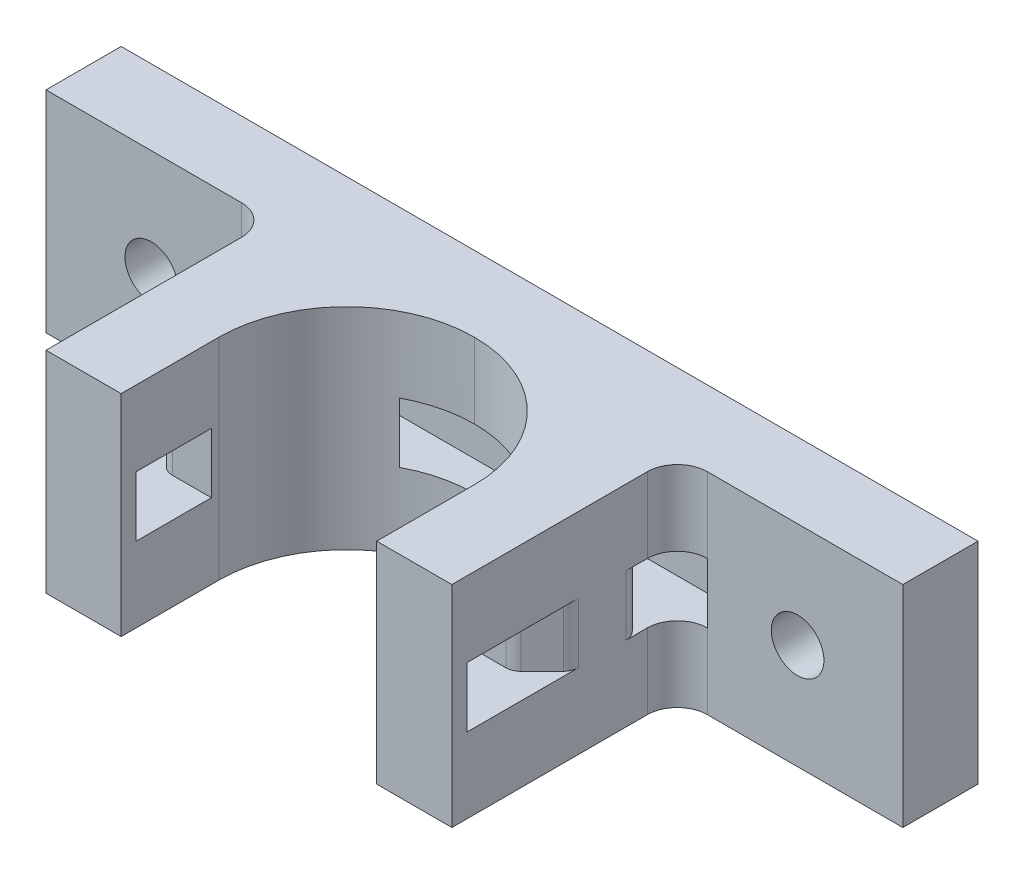
from build123d import *

# Parameters (mm, degrees)
ESQUISSE1_W             = 57
ESQUISSE1_H             = 14
ESQUISSE1_R             = 1.75
BOSS_EXTRU_1_DEPTH      = 5
ESQUISSE2_W             = 5
ESQUISSE2_H             = 14
BOSS_EXTRU_2_DEPTH      = 15
CONG_1_R                = 8.5
ESQUISSE3_W             = 5
ESQUISSE3_H             = 4
ESQUISSE3_W_2           = 3
ENL_V_MAT_EXTRU_1_DEPTH = 27
CHANFREIN1_SIZE         = 2
CONG_2_R                = 1
ESQUISSE6_W             = 0.628205128
ESQUISSE6_H             = 3.5
BOSS_EXTRU_3_DEPTH      = 0.5
CONG_3_R                = 2


with BuildPart() as part:
    # Esquisse1 → Boss.-Extru.1 (new body)
    with BuildSketch(Plane.XY):
        with Locations((28.5, -7)):
            Rectangle(ESQUISSE1_W, ESQUISSE1_H)
        with Locations((7, -7)):
            Circle(ESQUISSE1_R, mode=Mode.SUBTRACT)
        with Locations((50, -7)):
            Circle(ESQUISSE1_R, mode=Mode.SUBTRACT)
    extrude(amount=BOSS_EXTRU_1_DEPTH)

    # Esquisse2 → Boss.-Extru.2 (add)
    with BuildSketch(Plane.XY.offset(5)):
        with Locations((17.5, -7)):
            Rectangle(ESQUISSE2_W, ESQUISSE2_H)
        with Locations((39.5, -7)):
            Rectangle(ESQUISSE2_W, ESQUISSE2_H)
    extrude(amount=BOSS_EXTRU_2_DEPTH)

    # Congé1
    cong_1_edges = [part.edges().sort_by_distance(p)[0] for p in [
        (20, -7, 5),
        (37, -7, 5),
    ]]
    fillet(cong_1_edges, radius=CONG_1_R - 0.0001)  # a hair under: the kernel refuses the full size

    # Esquisse3 → Enlèv. mat.-Extru.1 (cut)
    with BuildSketch(Plane.ZY.offset(-15)):
        with Locations((16.5, -7)):
            Rectangle(ESQUISSE3_W, ESQUISSE3_H)
        with Locations((4.5, -7)):
            Rectangle(ESQUISSE3_W_2, ESQUISSE3_H)
    extrude(amount=-ENL_V_MAT_EXTRU_1_DEPTH, mode=Mode.SUBTRACT)

    # Chanfrein1
    chanfrein1_edges = [part.edges().sort_by_distance(p)[0] for p in [
        (42, -7, 14),
        (15, -7, 14),
        (42, -7, 5),
        (15, -7, 5),
        (15, -7, 6),
        (42, -7, 6),
    ]]
    chamfer(chanfrein1_edges, length=CHANFREIN1_SIZE - 0.0001)  # a hair under: the kernel refuses the full size

    # Congé2
    cong_2_edges = [part.edges().sort_by_distance(p)[0] for p in [
        (42, -7, 7.9999),
        (42, -7, 12.0001),
        (40.0001, -7, 14),
        (16.9999, -7, 14),
        (15, -7, 7.9999),
        (15, -7, 12.0001),
        (16.9999, -7, 6),
        (40.0001, -7, 6),
    ]]
    fillet(cong_2_edges, radius=CONG_2_R)

    # Esquisse6 → Boss.-Extru.3 (add)
    # profile 1 of 10: a face of its own
    with BuildSketch(Plane.XZ.offset(14)):
        with BuildLine():
            Line((16.069811699, 3.693309295), (15.594451122, 3.23828125))
            add(Edge.make_bspline(
                [(15.594451122, 3.23828125), (15.556815995, 3.27596147), (15.482969664, 3.349896282), (15.362203227, 3.446127521), (15.23712585, 3.527943098), (15.107325853, 3.595217589), (14.972622424, 3.647401533), (14.83328139, 3.684730378), (14.689076061, 3.706870748), (14.591455491, 3.709970324), (14.542067308, 3.711538462)],
                knots=[0, 0, 0, 0, 1.075575784, 2.110457258, 3.113929901, 4.09197124, 5.059417775, 6.02750972, 7.002078037, 8, 8, 8, 8], degree=3))
            add(Edge.make_bspline(
                [(14.542067308, 3.711538462), (14.499249263, 3.710439675), (14.415172278, 3.708282111), (14.291629247, 3.691897718), (14.173576313, 3.664528327), (14.060455745, 3.626612606), (13.952958184, 3.577272269), (13.850460769, 3.517268826), (13.753594269, 3.446143247), (13.663121439, 3.365243825), (13.580745636, 3.276917989), (13.508827211, 3.182378112), (13.447568163, 3.083386338), (13.397139473, 2.979436209), (13.358768723, 2.870687268), (13.331377029, 2.757218462), (13.313990115, 2.639359546), (13.31193724, 2.558954974), (13.310897436, 2.518229167)],
                knots=[0, 0, 0, 0, 1.075001177, 2.110859044, 3.123021556, 4.114053297, 5.101481495, 6.087880186, 7.091499647, 8.114004866, 9.131394192, 10.11971144, 11.092043119, 12.050101265, 13.015322563, 13.981809771, 14.977764287, 16, 16, 16, 16], degree=3))
            add(Edge.make_bspline(
                [(13.310897436, 2.518229167), (13.311867315, 2.476093785), (13.313778111, 2.393081314), (13.33213346, 2.271256945), (13.360413035, 2.154053124), (13.401806793, 2.042339475), (13.452749973, 1.934585677), (13.517354319, 1.832879025), (13.592689451, 1.735666345), (13.678620756, 1.644640167), (13.772091825, 1.560735938), (13.873324034, 1.48835799), (13.979237278, 1.425911444), (14.091541002, 1.376455798), (14.208285946, 1.336748333), (14.330656239, 1.308751162), (14.458376332, 1.291574995), (14.5455186, 1.289509688), (14.58974359, 1.288461538)],
                knots=[0, 0, 0, 0, 1.022067601, 2.013613092, 2.983553406, 3.943623673, 4.90013463, 5.87121881, 6.861774014, 7.881098904, 8.905697761, 9.905387765, 10.89678721, 11.884561068, 12.87834324, 13.885584958, 14.926927371, 16, 16, 16, 16], degree=3))
            add(Edge.make_bspline(
                [(14.58974359, 1.288461538), (14.618510308, 1.288721096), (14.674985776, 1.289230664), (14.757825663, 1.297502392), (14.837166378, 1.309327788), (14.913315185, 1.324983209), (14.985503185, 1.347138439), (15.054729871, 1.373046251), (15.120589636, 1.403622636), (15.182725394, 1.439922536), (15.242061906, 1.480610285), (15.298043771, 1.527165724), (15.351652976, 1.578539196), (15.402263105, 1.635358303), (15.449017566, 1.698131074), (15.493414254, 1.765703976), (15.534944835, 1.838747628), (15.55948416, 1.890327356), (15.572015224, 1.916666667)],
                knots=[0, 0, 0, 0, 1.109579412, 2.178351274, 3.208885622, 4.204702371, 5.174744997, 6.119429583, 7.05542196, 7.97267548, 8.893247984, 9.828544973, 10.778894627, 11.756245826, 12.760884819, 13.796418446, 14.874735809, 16, 16, 16, 16], degree=3))
            Line((15.572015224, 1.916666667), (14.567307692, 1.916666667))
            Line((14.567307692, 1.916666667), (14.567307692, 2.544871795))
            Line((14.567307692, 2.544871795), (16.31239984, 2.544871795))
            Line((16.31239984, 2.544871795), (16.317307692, 2.395532853))
            add(Edge.make_bspline(
                [(16.317307692, 2.395532853), (16.31667707, 2.357178823), (16.31541695, 2.28053921), (16.303900778, 2.166435882), (16.284824414, 2.053845899), (16.258745199, 1.942882342), (16.226061346, 1.833000895), (16.184379201, 1.725253766), (16.135569665, 1.618910248), (16.080882042, 1.514422219), (16.019428889, 1.414163115), (15.953265546, 1.319230978), (15.883335218, 1.229790116), (15.808116947, 1.147086663), (15.728782007, 1.070425875), (15.645174226, 1.000102674), (15.556997887, 0.936057559), (15.464720095, 0.877749495), (15.36781524, 0.826645917), (15.266816105, 0.782192583), (15.161875183, 0.744439306), (15.052721544, 0.713489831), (14.939569972, 0.689609849), (14.822418046, 0.673235314), (14.701201422, 0.662108633), (14.618982751, 0.660881282), (14.577123397, 0.66025641)],
                knots=[0, 0, 0, 0, 1.006889344, 2.011981806, 3.007738725, 4.003571281, 5.003404394, 6.015442001, 7.03424805, 8.074616296, 9.110249922, 10.119753985, 11.111721717, 12.089233633, 13.052717867, 14.006597561, 14.955430184, 15.912305663, 16.870361111, 17.829300583, 18.807640451, 19.796414044, 20.806216501, 21.841577364, 22.90109906, 24, 24, 24, 24], degree=3))
            add(Edge.make_bspline(
                [(14.577123397, 0.66025641), (14.532462306, 0.660873483), (14.443930701, 0.662096704), (14.313024858, 0.673553008), (14.185916675, 0.692460898), (14.062574448, 0.718628772), (13.942711802, 0.751196781), (13.826534678, 0.792077336), (13.714280692, 0.840706049), (13.605613693, 0.895795213), (13.501922566, 0.958271123), (13.403439698, 1.027038258), (13.310702628, 1.102538964), (13.222761441, 1.183509344), (13.141670782, 1.271939657), (13.06440872, 1.364963447), (12.994718338, 1.465992457), (12.929603155, 1.571751296), (12.871754306, 1.682195645), (12.821164656, 1.79528278), (12.778021831, 1.910357925), (12.744002671, 2.027956909), (12.716382299, 2.147259733), (12.696619405, 2.268785217), (12.685458375, 2.39251815), (12.683618423, 2.47567309), (12.682692308, 2.517528045)],
                knots=[0, 0, 0, 0, 1.084149091, 2.14910686, 3.187506334, 4.202448172, 5.208724393, 6.201130722, 7.189831603, 8.176984443, 9.156919086, 10.126598231, 11.090766514, 12.05840148, 13.026036446, 14.001772938, 14.991905635, 16.003017641, 17.015720547, 18.016462227, 19.009322657, 19.99686681, 20.986544154, 21.980959929, 22.983742515, 24, 24, 24, 24], degree=3))
            add(Edge.make_bspline(
                [(12.682692308, 2.517528045), (12.683932574, 2.574627147), (12.686381733, 2.687380945), (12.709064658, 2.853468005), (12.744423959, 3.014140663), (12.795168116, 3.168813761), (12.860284852, 3.317700363), (12.938851729, 3.461149986), (13.032575392, 3.599010157), (13.105123944, 3.68436475), (13.141927083, 3.727664263)],
                knots=[0, 0, 0, 0, 1.034044851, 2.041932006, 3.031217818, 4.011390712, 4.986069675, 5.97149666, 6.970960976, 8, 8, 8, 8], degree=3))
            add(Edge.make_bspline(
                [(13.141927083, 3.727664263), (13.164777793, 3.752714344), (13.210136108, 3.802438377), (13.282641292, 3.871530933), (13.356985228, 3.936480492), (13.434197591, 3.995909839), (13.513872489, 4.051119911), (13.596239243, 4.101075751), (13.680865774, 4.14736798), (13.768412066, 4.187632741), (13.858419804, 4.223733458), (13.951287617, 4.254279741), (14.046319944, 4.281336486), (14.1443583, 4.301919731), (14.244412263, 4.319059886), (14.347192051, 4.330548115), (14.452417581, 4.338968169), (14.523586837, 4.339483072), (14.559595353, 4.33974359)],
                knots=[0, 0, 0, 0, 1.020590567, 2.025856924, 3.013483481, 3.991664875, 4.957826714, 5.930500614, 6.890802512, 7.860442893, 8.829981142, 9.809047939, 10.802672283, 11.803273349, 12.823572789, 13.857849586, 14.916166035, 16, 16, 16, 16], degree=3))
            add(Edge.make_bspline(
                [(14.559595353, 4.33974359), (14.597235942, 4.339163107), (14.672126895, 4.33800816), (14.783477339, 4.330016678), (14.893280494, 4.317687706), (15.001073639, 4.299193543), (15.107218527, 4.276386391), (15.211165729, 4.247164785), (15.313593369, 4.213963776), (15.380273376, 4.187493479), (15.413561699, 4.174278846)],
                knots=[0, 0, 0, 0, 1.03180557, 2.052914215, 3.058998889, 4.059601663, 5.049854447, 6.033765722, 7.018406786, 8, 8, 8, 8], degree=3))
            add(Edge.make_bspline(
                [(15.413561699, 4.174278846), (15.441569705, 4.162066147), (15.498537214, 4.137225854), (15.581417919, 4.091779374), (15.664501124, 4.041396735), (15.746890319, 3.984235831), (15.828459967, 3.920403578), (15.910061741, 3.850908197), (15.99086262, 3.774939333), (16.043154524, 3.720871696), (16.069811699, 3.693309295)],
                knots=[0, 0, 0, 0, 0.894392155, 1.819168899, 2.76525314, 3.739198753, 4.75366411, 5.797420238, 6.877176959, 8, 8, 8, 8], degree=3))
        make_face()
    # profile 2 of 10: a face of its own
    with BuildSketch(Plane.XZ.offset(14)):
        with BuildLine():
            Line((16.945512821, 4.25), (17.573717949, 4.25))
            Line((17.573717949, 4.25), (17.573717949, 1.97275641))
            add(Edge.make_bspline(
                [(17.573717949, 1.97275641), (17.573752107, 1.949146936), (17.573818085, 1.903545482), (17.577120936, 1.838122324), (17.580143273, 1.777984744), (17.585596427, 1.72319858), (17.593652603, 1.673740395), (17.601453611, 1.629292488), (17.612011504, 1.590650649), (17.62787833, 1.54666612), (17.652323898, 1.497247098), (17.692266602, 1.44574146), (17.738357064, 1.39873509), (17.793599138, 1.359608768), (17.855686344, 1.327959101), (17.92427754, 1.3045102), (17.999276037, 1.291475724), (18.051133384, 1.289485773), (18.077824519, 1.288461538)],
                knots=[0, 0, 0, 0, 1.155499968, 2.231836252, 3.205919964, 4.102923608, 4.924856345, 5.658536265, 6.31071849, 6.882491295, 7.94666036, 8.992281882, 10.060072772, 11.158554251, 12.289267114, 13.461410017, 14.693379945, 16, 16, 16, 16], degree=3))
            add(Edge.make_bspline(
                [(18.077824519, 1.288461538), (18.106180557, 1.289288988), (18.161470029, 1.290902375), (18.240995134, 1.306739513), (18.314675594, 1.33195766), (18.380951343, 1.367950384), (18.439756427, 1.411093971), (18.489533697, 1.46029118), (18.528817737, 1.515640135), (18.554421612, 1.566703761), (18.568796927, 1.613703381), (18.579571942, 1.655695759), (18.58747122, 1.705242608), (18.594637704, 1.761570148), (18.59894421, 1.825261823), (18.603613912, 1.895805416), (18.605325402, 1.973683606), (18.605617113, 2.027911652), (18.605769231, 2.056189904)],
                knots=[0, 0, 0, 0, 1.261321664, 2.459363699, 3.594844139, 4.716940403, 5.803436589, 6.833651888, 7.818396249, 8.814403945, 9.360733334, 10.004355033, 10.743453831, 11.592799886, 12.532235708, 13.585170094, 14.740740724, 16, 16, 16, 16], degree=3))
            Line((18.605769231, 2.056189904), (18.605769231, 4.25))
            Line((18.605769231, 4.25), (19.233974359, 4.25))
            Line((19.233974359, 4.25), (19.233974359, 2.162059295))
            add(Edge.make_bspline(
                [(19.233974359, 2.162059295), (19.233887121, 2.119757716), (19.233719372, 2.038415905), (19.231143244, 1.921521999), (19.225659133, 1.814758166), (19.221053113, 1.718093211), (19.212138887, 1.631657357), (19.202852354, 1.555081498), (19.191015869, 1.488637002), (19.173403891, 1.412998018), (19.143010831, 1.325902498), (19.094013234, 1.225615782), (19.031813955, 1.127429012), (18.958297517, 1.032422312), (18.875290733, 0.944164148), (18.784634042, 0.866684905), (18.687767753, 0.80114582), (18.583679683, 0.749149403), (18.472458416, 0.708596117), (18.353003501, 0.681346352), (18.225396396, 0.662936068), (18.137255757, 0.661167534), (18.091846955, 0.66025641)],
                knots=[0, 0, 0, 0, 1.170808336, 2.251350247, 3.235597562, 4.129743112, 4.929140599, 5.639994148, 6.264258765, 6.79612947, 7.788252245, 8.809469599, 9.879094798, 10.999557536, 12.129761673, 13.226370002, 14.293821979, 15.358369427, 16.438775801, 17.562147481, 18.744053101, 20, 20, 20, 20], degree=3))
            add(Edge.make_bspline(
                [(18.091846955, 0.66025641), (18.061676444, 0.660764593), (18.002150644, 0.661767226), (17.914607512, 0.670607835), (17.829979879, 0.683635567), (17.748426758, 0.702641687), (17.669665094, 0.727194045), (17.593715813, 0.757416287), (17.52086116, 0.793139837), (17.45150882, 0.834036118), (17.385744136, 0.878258405), (17.32563861, 0.927280672), (17.269123869, 0.977477536), (17.2178326, 1.030961496), (17.171379561, 1.087171061), (17.129860422, 1.146233619), (17.093336866, 1.208143926), (17.060890163, 1.27401791), (17.033118952, 1.347203708), (17.009706777, 1.430304569), (16.989253351, 1.524623017), (16.974053571, 1.630371546), (16.960273362, 1.74720162), (16.951551249, 1.875417599), (16.946988319, 2.015023163), (16.946017081, 2.111808806), (16.945512821, 2.162059295)],
                knots=[0, 0, 0, 0, 1.001158378, 1.975264943, 2.917723546, 3.841610987, 4.75185031, 5.653588123, 6.552117133, 7.442167995, 8.324307438, 9.179605724, 10.014504199, 10.831958861, 11.636465792, 12.43274043, 13.225645099, 14.020104002, 14.867201867, 15.819789774, 16.883317127, 18.068162734, 19.364263498, 20.787406516, 22.332041935, 24, 24, 24, 24], degree=3))
            Line((16.945512821, 2.162059295), (16.945512821, 4.25))
        make_face()
    # profile 3 of 10: a face of its own
    with BuildSketch(Plane.XZ.offset(14)):
        with Locations((20.266025641, 2.5)):
            Rectangle(ESQUISSE6_W, ESQUISSE6_H)
    # profile 4 of 10: a face of its own
    with BuildSketch(Plane.XZ.offset(14)):
        with BuildLine():
            Line((24.595452724, 3.693309295), (24.120092147, 3.23828125))
            add(Edge.make_bspline(
                [(24.120092147, 3.23828125), (24.082457021, 3.27596147), (24.00861069, 3.349896282), (23.887844253, 3.446127521), (23.762766876, 3.527943098), (23.632966879, 3.595217589), (23.498263449, 3.647401533), (23.358922416, 3.684730378), (23.214717087, 3.706870748), (23.117096517, 3.709970324), (23.067708333, 3.711538462)],
                knots=[0, 0, 0, 0, 1.075575784, 2.110457258, 3.113929901, 4.09197124, 5.059417775, 6.02750972, 7.002078037, 8, 8, 8, 8], degree=3))
            add(Edge.make_bspline(
                [(23.067708333, 3.711538462), (23.024890288, 3.710439675), (22.940813304, 3.708282111), (22.817270273, 3.691897718), (22.699217339, 3.664528327), (22.586096771, 3.626612606), (22.47859921, 3.577272269), (22.376101795, 3.517268826), (22.279235295, 3.446143247), (22.188762465, 3.365243825), (22.106386662, 3.276917989), (22.034468237, 3.182378112), (21.973209188, 3.083386338), (21.922780498, 2.979436209), (21.884409749, 2.870687268), (21.857018055, 2.757218462), (21.839631141, 2.639359546), (21.837578266, 2.558954974), (21.836538462, 2.518229167)],
                knots=[0, 0, 0, 0, 1.075001177, 2.110859044, 3.123021556, 4.114053297, 5.101481495, 6.087880186, 7.091499647, 8.114004866, 9.131394192, 10.11971144, 11.092043119, 12.050101265, 13.015322563, 13.981809771, 14.977764287, 16, 16, 16, 16], degree=3))
            add(Edge.make_bspline(
                [(21.836538462, 2.518229167), (21.837508341, 2.476093785), (21.839419136, 2.393081314), (21.857774485, 2.271256945), (21.886054061, 2.154053124), (21.927447819, 2.042339475), (21.978390999, 1.934585677), (22.042995345, 1.832879025), (22.118330477, 1.735666345), (22.204261782, 1.644640167), (22.297732851, 1.560735938), (22.398965059, 1.48835799), (22.504878303, 1.425911444), (22.617182028, 1.376455798), (22.733926972, 1.336748333), (22.856297264, 1.308751162), (22.984017358, 1.291574995), (23.071159626, 1.289509688), (23.115384615, 1.288461538)],
                knots=[0, 0, 0, 0, 1.022067601, 2.013613092, 2.983553406, 3.943623673, 4.90013463, 5.87121881, 6.861774014, 7.881098904, 8.905697761, 9.905387765, 10.89678721, 11.884561068, 12.87834324, 13.885584958, 14.926927371, 16, 16, 16, 16], degree=3))
            add(Edge.make_bspline(
                [(23.115384615, 1.288461538), (23.144151333, 1.288721096), (23.200626801, 1.289230664), (23.283466689, 1.297502392), (23.362807403, 1.309327788), (23.43895621, 1.324983209), (23.511144211, 1.347138439), (23.580370897, 1.373046251), (23.646230661, 1.403622636), (23.708366419, 1.439922536), (23.767702932, 1.480610285), (23.823684796, 1.527165724), (23.877294001, 1.578539196), (23.92790413, 1.635358303), (23.974658592, 1.698131074), (24.01905528, 1.765703976), (24.060585861, 1.838747628), (24.085125185, 1.890327356), (24.09765625, 1.916666667)],
                knots=[0, 0, 0, 0, 1.109579412, 2.178351274, 3.208885622, 4.204702371, 5.174744997, 6.119429583, 7.05542196, 7.97267548, 8.893247984, 9.828544973, 10.778894627, 11.756245826, 12.760884819, 13.796418446, 14.874735809, 16, 16, 16, 16], degree=3))
            Line((24.09765625, 1.916666667), (23.092948718, 1.916666667))
            Line((23.092948718, 1.916666667), (23.092948718, 2.544871795))
            Line((23.092948718, 2.544871795), (24.838040865, 2.544871795))
            Line((24.838040865, 2.544871795), (24.842948718, 2.395532853))
            add(Edge.make_bspline(
                [(24.842948718, 2.395532853), (24.842318095, 2.357178823), (24.841057976, 2.28053921), (24.829541804, 2.166435882), (24.81046544, 2.053845899), (24.784386225, 1.942882342), (24.751702371, 1.833000895), (24.710020227, 1.725253766), (24.66121069, 1.618910248), (24.606523068, 1.514422219), (24.545069915, 1.414163115), (24.478906572, 1.319230978), (24.408976243, 1.229790116), (24.333757973, 1.147086663), (24.254423033, 1.070425875), (24.170815251, 1.000102674), (24.082638912, 0.936057559), (23.990361121, 0.877749495), (23.893456266, 0.826645917), (23.79245713, 0.782192583), (23.687516209, 0.744439306), (23.578362569, 0.713489831), (23.465210998, 0.689609849), (23.348059071, 0.673235314), (23.226842448, 0.662108633), (23.144623776, 0.660881282), (23.102764423, 0.66025641)],
                knots=[0, 0, 0, 0, 1.006889344, 2.011981806, 3.007738725, 4.003571281, 5.003404394, 6.015442001, 7.03424805, 8.074616296, 9.110249922, 10.119753985, 11.111721717, 12.089233633, 13.052717867, 14.006597561, 14.955430184, 15.912305663, 16.870361111, 17.829300583, 18.807640451, 19.796414044, 20.806216501, 21.841577364, 22.90109906, 24, 24, 24, 24], degree=3))
            add(Edge.make_bspline(
                [(23.102764423, 0.66025641), (23.058103331, 0.660873483), (22.969571727, 0.662096704), (22.838665884, 0.673553008), (22.711557701, 0.692460898), (22.588215474, 0.718628772), (22.468352827, 0.751196781), (22.352175704, 0.792077336), (22.239921717, 0.840706049), (22.131254719, 0.895795213), (22.027563591, 0.958271123), (21.929080724, 1.027038258), (21.836343654, 1.102538964), (21.748402466, 1.183509344), (21.667311808, 1.271939657), (21.590049746, 1.364963447), (21.520359363, 1.465992457), (21.45524418, 1.571751296), (21.397395332, 1.682195645), (21.346805682, 1.79528278), (21.303662857, 1.910357925), (21.269643697, 2.027956909), (21.242023325, 2.147259733), (21.22226043, 2.268785217), (21.2110994, 2.39251815), (21.209259449, 2.47567309), (21.208333333, 2.517528045)],
                knots=[0, 0, 0, 0, 1.084149091, 2.14910686, 3.187506334, 4.202448172, 5.208724393, 6.201130722, 7.189831603, 8.176984443, 9.156919086, 10.126598231, 11.090766514, 12.05840148, 13.026036446, 14.001772938, 14.991905635, 16.003017641, 17.015720547, 18.016462227, 19.009322657, 19.99686681, 20.986544154, 21.980959929, 22.983742515, 24, 24, 24, 24], degree=3))
            add(Edge.make_bspline(
                [(21.208333333, 2.517528045), (21.2095736, 2.574627147), (21.212022758, 2.687380945), (21.234705683, 2.853468005), (21.270064984, 3.014140663), (21.320809141, 3.168813761), (21.385925877, 3.317700363), (21.464492755, 3.461149986), (21.558216418, 3.599010157), (21.63076497, 3.68436475), (21.667568109, 3.727664263)],
                knots=[0, 0, 0, 0, 1.034044851, 2.041932006, 3.031217818, 4.011390712, 4.986069675, 5.97149666, 6.970960976, 8, 8, 8, 8], degree=3))
            add(Edge.make_bspline(
                [(21.667568109, 3.727664263), (21.690418819, 3.752714344), (21.735777134, 3.802438377), (21.808282318, 3.871530933), (21.882626253, 3.936480492), (21.959838616, 3.995909839), (22.039513515, 4.051119911), (22.121880268, 4.101075751), (22.206506799, 4.14736798), (22.294053092, 4.187632741), (22.38406083, 4.223733458), (22.476928643, 4.254279741), (22.57196097, 4.281336486), (22.669999326, 4.301919731), (22.770053289, 4.319059886), (22.872833076, 4.330548115), (22.978058606, 4.338968169), (23.049227862, 4.339483072), (23.085236378, 4.33974359)],
                knots=[0, 0, 0, 0, 1.020590567, 2.025856924, 3.013483481, 3.991664875, 4.957826714, 5.930500614, 6.890802512, 7.860442893, 8.829981142, 9.809047939, 10.802672283, 11.803273349, 12.823572789, 13.857849586, 14.916166035, 16, 16, 16, 16], degree=3))
            add(Edge.make_bspline(
                [(23.085236378, 4.33974359), (23.122876968, 4.339163107), (23.19776792, 4.33800816), (23.309118364, 4.330016678), (23.418921519, 4.317687706), (23.526714664, 4.299193543), (23.632859553, 4.276386391), (23.736806754, 4.247164785), (23.839234395, 4.213963776), (23.905914401, 4.187493479), (23.939202724, 4.174278846)],
                knots=[0, 0, 0, 0, 1.03180557, 2.052914215, 3.058998889, 4.059601663, 5.049854447, 6.033765722, 7.018406786, 8, 8, 8, 8], degree=3))
            add(Edge.make_bspline(
                [(23.939202724, 4.174278846), (23.96721073, 4.162066147), (24.02417824, 4.137225854), (24.107058945, 4.091779374), (24.19014215, 4.041396735), (24.272531345, 3.984235831), (24.354100993, 3.920403578), (24.435702766, 3.850908197), (24.516503646, 3.774939333), (24.568795549, 3.720871696), (24.595452724, 3.693309295)],
                knots=[0, 0, 0, 0, 0.894392155, 1.819168899, 2.76525314, 3.739198753, 4.75366411, 5.797420238, 6.877176959, 8, 8, 8, 8], degree=3))
        make_face()
    # profile 5 of 10: a face of its own
    with BuildSketch(Plane.XZ.offset(14)):
        with BuildLine():
            Line((25.471153846, 4.25), (26.099358974, 4.25))
            Line((26.099358974, 4.25), (26.099358974, 1.97275641))
            add(Edge.make_bspline(
                [(26.099358974, 1.97275641), (26.099393133, 1.949146936), (26.09945911, 1.903545482), (26.102761962, 1.838122324), (26.105784299, 1.777984744), (26.111237452, 1.72319858), (26.119293629, 1.673740395), (26.127094637, 1.629292488), (26.13765253, 1.590650649), (26.153519355, 1.54666612), (26.177964924, 1.497247098), (26.217907627, 1.44574146), (26.26399809, 1.39873509), (26.319240164, 1.359608768), (26.38132737, 1.327959101), (26.449918566, 1.3045102), (26.524917063, 1.291475724), (26.576774409, 1.289485773), (26.603465545, 1.288461538)],
                knots=[0, 0, 0, 0, 1.155499968, 2.231836252, 3.205919964, 4.102923608, 4.924856345, 5.658536265, 6.31071849, 6.882491295, 7.94666036, 8.992281882, 10.060072772, 11.158554251, 12.289267114, 13.461410017, 14.693379945, 16, 16, 16, 16], degree=3))
            add(Edge.make_bspline(
                [(26.603465545, 1.288461538), (26.631821582, 1.289288988), (26.687111055, 1.290902375), (26.766636159, 1.306739513), (26.840316619, 1.33195766), (26.906592369, 1.367950384), (26.965397452, 1.411093971), (27.015174723, 1.46029118), (27.054458763, 1.515640135), (27.080062638, 1.566703761), (27.094437953, 1.613703381), (27.105212968, 1.655695759), (27.113112246, 1.705242608), (27.12027873, 1.761570148), (27.124585235, 1.825261823), (27.129254938, 1.895805416), (27.130966427, 1.973683606), (27.131258138, 2.027911652), (27.131410256, 2.056189904)],
                knots=[0, 0, 0, 0, 1.261321664, 2.459363699, 3.594844139, 4.716940403, 5.803436589, 6.833651888, 7.818396249, 8.814403945, 9.360733334, 10.004355033, 10.743453831, 11.592799886, 12.532235708, 13.585170094, 14.740740724, 16, 16, 16, 16], degree=3))
            Line((27.131410256, 2.056189904), (27.131410256, 4.25))
            Line((27.131410256, 4.25), (27.759615385, 4.25))
            Line((27.759615385, 4.25), (27.759615385, 2.162059295))
            add(Edge.make_bspline(
                [(27.759615385, 2.162059295), (27.759528147, 2.119757716), (27.759360397, 2.038415905), (27.756784269, 1.921521999), (27.751300159, 1.814758166), (27.746694139, 1.718093211), (27.737779912, 1.631657357), (27.728493379, 1.555081498), (27.716656894, 1.488637002), (27.699044917, 1.412998018), (27.668651857, 1.325902498), (27.619654259, 1.225615782), (27.557454981, 1.127429012), (27.483938542, 1.032422312), (27.400931758, 0.944164148), (27.310275067, 0.866684905), (27.213408778, 0.80114582), (27.109320708, 0.749149403), (26.998099441, 0.708596117), (26.878644526, 0.681346352), (26.751037422, 0.662936068), (26.662896783, 0.661167534), (26.617487981, 0.66025641)],
                knots=[0, 0, 0, 0, 1.170808336, 2.251350247, 3.235597562, 4.129743112, 4.929140599, 5.639994148, 6.264258765, 6.79612947, 7.788252245, 8.809469599, 9.879094798, 10.999557536, 12.129761673, 13.226370002, 14.293821979, 15.358369427, 16.438775801, 17.562147481, 18.744053101, 20, 20, 20, 20], degree=3))
            add(Edge.make_bspline(
                [(26.617487981, 0.66025641), (26.587317469, 0.660764593), (26.527791669, 0.661767226), (26.440248538, 0.670607835), (26.355620904, 0.683635567), (26.274067784, 0.702641687), (26.19530612, 0.727194045), (26.119356839, 0.757416287), (26.046502186, 0.793139837), (25.977149846, 0.834036118), (25.911385162, 0.878258405), (25.851279635, 0.927280672), (25.794764894, 0.977477536), (25.743473626, 1.030961496), (25.697020587, 1.087171061), (25.655501448, 1.146233619), (25.618977891, 1.208143926), (25.586531188, 1.27401791), (25.558759977, 1.347203708), (25.535347803, 1.430304569), (25.514894377, 1.524623017), (25.499694597, 1.630371546), (25.485914388, 1.74720162), (25.477192275, 1.875417599), (25.472629345, 2.015023163), (25.471658107, 2.111808806), (25.471153846, 2.162059295)],
                knots=[0, 0, 0, 0, 1.001158378, 1.975264943, 2.917723546, 3.841610987, 4.75185031, 5.653588123, 6.552117133, 7.442167995, 8.324307438, 9.179605724, 10.014504199, 10.831958861, 11.636465792, 12.43274043, 13.225645099, 14.020104002, 14.867201867, 15.819789774, 16.883317127, 18.068162734, 19.364263498, 20.787406516, 22.332041935, 24, 24, 24, 24], degree=3))
            Line((25.471153846, 2.162059295), (25.471153846, 4.25))
        make_face()
    # profile 6 of 10: a face of its own
    with BuildSketch(Plane.XZ.offset(14)):
        with BuildLine():
            Line((28.567307692, 4.25), (29.299278846, 4.25))
            add(Edge.make_bspline(
                [(29.299278846, 4.25), (29.347661917, 4.249828268), (29.44071619, 4.249497979), (29.574895369, 4.244286889), (29.698157398, 4.23703523), (29.810684778, 4.225969006), (29.912429366, 4.21129653), (30.003493135, 4.194000109), (30.083873423, 4.17428713), (30.154248127, 4.149723202), (30.217757818, 4.122015463), (30.276957679, 4.090178764), (30.333153748, 4.054567615), (30.385970414, 4.014244991), (30.435866667, 3.969936286), (30.482936639, 3.921596899), (30.526515188, 3.868816932), (30.566332473, 3.811929887), (30.602622723, 3.75208602), (30.634695693, 3.689203166), (30.660777486, 3.623237592), (30.683823546, 3.555142645), (30.700422876, 3.483944894), (30.711967467, 3.410337461), (30.720419965, 3.33406124), (30.720905943, 3.282242562), (30.721153846, 3.255809295)],
                knots=[0, 0, 0, 0, 1.749336639, 3.364467119, 4.854658419, 6.213483162, 7.451590619, 8.570285859, 9.5643256, 10.440900261, 11.26203566, 12.067320669, 12.869050712, 13.665104639, 14.467235401, 15.27997916, 16.102287765, 16.939272006, 17.78853747, 18.631303466, 19.488103222, 20.351255419, 21.228522269, 22.127379805, 23.044756219, 24, 24, 24, 24], degree=3))
            add(Edge.make_bspline(
                [(30.721153846, 3.255809295), (30.720509884, 3.228219036), (30.719247192, 3.174119568), (30.712445643, 3.094651861), (30.700014549, 3.018622717), (30.681185848, 2.946254741), (30.659544703, 2.876647229), (30.63076753, 2.811084482), (30.598289647, 2.748612986), (30.559716614, 2.690116424), (30.517384594, 2.634295469), (30.468153346, 2.583288831), (30.415212298, 2.534355094), (30.35558544, 2.490559303), (30.291901181, 2.448940145), (30.22289418, 2.411222103), (30.149014802, 2.376457035), (30.097073941, 2.357069631), (30.070512821, 2.347155449)],
                knots=[0, 0, 0, 0, 1.099860209, 2.156625411, 3.176576793, 4.16617041, 5.135385252, 6.078461593, 7.016046972, 7.938469504, 8.868247731, 9.803980173, 10.76021508, 11.73834243, 12.748633912, 13.790971185, 14.870363756, 16, 16, 16, 16], degree=3))
            Line((30.070512821, 2.347155449), (30.878205128, 0.75))
            Line((30.878205128, 0.75), (30.179887821, 0.75))
            Line((30.179887821, 0.75), (29.408653846, 2.275641026))
            Line((29.408653846, 2.275641026), (29.195512821, 2.275641026))
            Line((29.195512821, 2.275641026), (29.195512821, 0.75))
            Line((29.195512821, 0.75), (28.567307692, 0.75))
            Line((28.567307692, 0.75), (28.567307692, 4.25))
        make_face()
        with BuildLine():
            Line((29.195512821, 2.903846154), (29.440204327, 2.903846154))
            add(Edge.make_bspline(
                [(29.440204327, 2.903846154), (29.470119898, 2.904183083), (29.527401787, 2.90482823), (29.609780668, 2.90782069), (29.684600338, 2.91503104), (29.752182099, 2.924141047), (29.812866015, 2.934659866), (29.866110807, 2.949733972), (29.912736896, 2.965886258), (29.952191762, 2.98595936), (29.985901093, 3.008786831), (30.015006943, 3.034719405), (30.039081654, 3.064733058), (30.058896369, 3.098012147), (30.074310063, 3.134851019), (30.085560879, 3.174845265), (30.091848421, 3.218450472), (30.092571824, 3.248544002), (30.092948718, 3.264222756)],
                knots=[0, 0, 0, 0, 1.688639943, 3.233382647, 4.650958383, 5.928841754, 7.082724185, 8.122798841, 9.049171256, 9.863274652, 10.613301712, 11.341792392, 12.054588806, 12.776240173, 13.521029143, 14.301969904, 15.115324896, 16, 16, 16, 16], degree=3))
            add(Edge.make_bspline(
                [(30.092948718, 3.264222756), (30.092236166, 3.282771868), (30.09083649, 3.319208159), (30.076947352, 3.371663643), (30.054838846, 3.420214782), (30.024534138, 3.46464221), (29.986369299, 3.50359036), (29.942572135, 3.537923465), (29.892197398, 3.565071516), (29.845554182, 3.582978081), (29.803119758, 3.593691763), (29.76482403, 3.601675505), (29.720477345, 3.607333812), (29.670046225, 3.613335453), (29.613659221, 3.617227214), (29.55100899, 3.620067423), (29.482275462, 3.621229493), (29.434361666, 3.621600986), (29.409354968, 3.621794872)],
                knots=[0, 0, 0, 0, 1.020303359, 2.004196876, 2.966617323, 3.9489082, 4.950758222, 5.960522915, 7.003732012, 8.091992268, 8.70421221, 9.413913587, 10.24622431, 11.166358409, 12.212345909, 13.359657661, 14.621978493, 16, 16, 16, 16], degree=3))
            Line((29.409354968, 3.621794872), (29.195512821, 3.621794872))
            Line((29.195512821, 3.621794872), (29.195512821, 2.903846154))
        make_face(mode=Mode.SUBTRACT)
    # profile 7 of 10: a face of its own
    with BuildSketch(Plane.XZ.offset(14)):
        with BuildLine():
            add(Edge.make_bspline(
                [(31.641025641, 1.467948718), (31.666385537, 1.466558296), (31.716314793, 1.463820795), (31.78845576, 1.44339111), (31.853563398, 1.406686271), (31.911778325, 1.358811171), (31.961003402, 1.301211032), (31.996582174, 1.235525117), (32.018737968, 1.16366212), (32.021183984, 1.11357578), (32.022435897, 1.087940705)],
                knots=[0, 0, 0, 0, 1.016957001, 2.002212695, 2.9757545, 3.99499976, 5.013036768, 5.994806404, 6.97370641, 8, 8, 8, 8], degree=3))
            add(Edge.make_bspline(
                [(32.022435897, 1.087940705), (32.021192185, 1.062301513), (32.018762193, 1.012207129), (31.996428859, 0.940204101), (31.961056568, 0.873978308), (31.911774376, 0.815760947), (31.853804486, 0.766983595), (31.788306066, 0.730617228), (31.71645222, 0.70902862), (31.666409726, 0.706440852), (31.641025641, 0.705128205)],
                knots=[0, 0, 0, 0, 1.023218912, 1.999186227, 2.986238111, 4.008388923, 5.030539734, 6.0011649, 6.986089706, 8, 8, 8, 8], degree=3))
            add(Edge.make_bspline(
                [(31.641025641, 0.705128205), (31.615635541, 0.706430178), (31.56558119, 0.708996903), (31.493615652, 0.730799199), (31.427633672, 0.766740799), (31.369649217, 0.815820114), (31.320146854, 0.873772156), (31.28578023, 0.940413056), (31.263238867, 1.012179983), (31.260842095, 1.062292323), (31.259615385, 1.087940705)],
                knots=[0, 0, 0, 0, 1.013427518, 1.99788335, 2.976245624, 3.997909735, 5.019573847, 6.001765691, 6.977268297, 8, 8, 8, 8], degree=3))
            add(Edge.make_bspline(
                [(31.259615385, 1.087940705), (31.260850188, 1.113585131), (31.263262772, 1.163689738), (31.285627351, 1.235313756), (31.320201932, 1.301418305), (31.369645089, 1.358751881), (31.427876002, 1.406927172), (31.493465118, 1.443211633), (31.565718548, 1.463852746), (31.615659702, 1.466569058), (31.641025641, 1.467948718)],
                knots=[0, 0, 0, 0, 1.025808215, 2.00424526, 2.981110158, 3.998665696, 5.017428914, 5.998734231, 6.983523959, 8, 8, 8, 8], degree=3))
        make_face()
    # profile 8 of 10: a face of its own
    with BuildSketch(Plane.XZ.offset(14)):
        with BuildLine():
            Line((35.881410256, 3.642828526), (35.420773237, 3.202524038))
            add(Edge.make_bspline(
                [(35.420773237, 3.202524038), (35.381698252, 3.242927638), (35.305372566, 3.321848526), (35.182383161, 3.426332827), (35.054478658, 3.513406355), (34.924147183, 3.586739125), (34.789044452, 3.642220593), (34.65073262, 3.682650872), (34.508328525, 3.707299686), (34.41195491, 3.710119946), (34.363481571, 3.711538462)],
                knots=[0, 0, 0, 0, 1.115251505, 2.178435587, 3.19620269, 4.182487026, 5.141301733, 6.088180966, 7.038406374, 8, 8, 8, 8], degree=3))
            add(Edge.make_bspline(
                [(34.363481571, 3.711538462), (34.323000441, 3.710417785), (34.243115393, 3.708206253), (34.125823208, 3.691993543), (34.013627171, 3.664423124), (33.906143218, 3.626425979), (33.803687624, 3.57725969), (33.706045579, 3.516962311), (33.613457816, 3.446078413), (33.527147364, 3.364974752), (33.448193595, 3.276362907), (33.378432914, 3.181814281), (33.319997153, 3.081545478), (33.272039875, 2.976571947), (33.234683008, 2.866407818), (33.208005513, 2.75112726), (33.192575962, 2.63059298), (33.190272998, 2.548654675), (33.189102564, 2.507011218)],
                knots=[0, 0, 0, 0, 1.035432265, 2.043311493, 3.022114605, 3.98653278, 4.95457646, 5.923598177, 6.917315552, 7.932509744, 8.948865224, 9.949768934, 10.933144597, 11.912367597, 12.897413939, 13.903909035, 14.934704909, 16, 16, 16, 16], degree=3))
            add(Edge.make_bspline(
                [(33.189102564, 2.507011218), (33.18943987, 2.477782926), (33.190104706, 2.420173362), (33.197382518, 2.334952828), (33.20910151, 2.252268764), (33.226061795, 2.172246412), (33.247270799, 2.094816425), (33.272153789, 2.01931082), (33.303369135, 1.946772912), (33.338018639, 1.876360221), (33.378315614, 1.809994047), (33.421763186, 1.746708391), (33.468874984, 1.686813475), (33.519956155, 1.63055415), (33.575725602, 1.578809624), (33.634741891, 1.530023877), (33.698000545, 1.485418182), (33.764187523, 1.44387311), (33.833874595, 1.407782552), (33.905170989, 1.375091479), (33.979157704, 1.348541467), (34.054933906, 1.327139735), (34.132228798, 1.308940759), (34.211798395, 1.29773509), (34.292952929, 1.289249168), (34.347799772, 1.288725212), (34.375400641, 1.288461538)],
                knots=[0, 0, 0, 0, 1.103660481, 2.175337485, 3.227646561, 4.255952547, 5.262355991, 6.258840057, 7.255597736, 8.242457506, 9.22035537, 10.185017736, 11.140346927, 12.096287581, 13.051739095, 14.01125915, 14.986044842, 15.97314143, 16.960198552, 17.947847494, 18.933482797, 19.925264591, 20.920966487, 21.929612487, 22.958107872, 24, 24, 24, 24], degree=3))
            add(Edge.make_bspline(
                [(34.375400641, 1.288461538), (34.422216458, 1.2898157), (34.514197364, 1.292476276), (34.64919257, 1.313281603), (34.777829552, 1.347505189), (34.880609885, 1.387921255), (34.961135562, 1.427832645), (35.022438569, 1.464748715), (35.085830656, 1.506043392), (35.150258935, 1.553275183), (35.216448096, 1.605877287), (35.283229748, 1.665001788), (35.352313513, 1.728701801), (35.397569602, 1.774165752), (35.420773237, 1.797475962)],
                knots=[0, 0, 0, 0, 1.404581149, 2.759636711, 4.088442092, 5.392261763, 6.066678138, 6.783632037, 7.538459478, 8.336747902, 9.180226004, 10.074962426, 11.012997595, 12, 12, 12, 12], degree=3))
            Line((35.420773237, 1.797475962), (35.867387821, 1.328425481))
            add(Edge.make_bspline(
                [(35.867387821, 1.328425481), (35.835993219, 1.298114979), (35.774717672, 1.238955361), (35.682285209, 1.154954225), (35.589969076, 1.079469865), (35.499999439, 1.009762532), (35.4109025, 0.947862968), (35.322687709, 0.893709355), (35.236353695, 0.845932068), (35.150107706, 0.805336849), (35.063413073, 0.770867291), (34.974214484, 0.741191265), (34.88223925, 0.716086414), (34.786925628, 0.695830096), (34.689162647, 0.679587264), (34.588035373, 0.668623446), (34.484185005, 0.661252837), (34.413741691, 0.660590526), (34.378205128, 0.66025641)],
                knots=[0, 0, 0, 0, 1.244526981, 2.429050516, 3.560637417, 4.644440555, 5.67424972, 6.652764056, 7.595344123, 8.486817594, 9.369275933, 10.254498637, 11.166417451, 12.086725134, 13.032340136, 13.991389299, 14.986715468, 16, 16, 16, 16], degree=3))
            add(Edge.make_bspline(
                [(34.378205128, 0.66025641), (34.312928864, 0.661920432), (34.18520136, 0.665176461), (33.998020034, 0.68930143), (33.820202798, 0.729746515), (33.651317057, 0.786947022), (33.491416513, 0.860017988), (33.340542073, 0.949599561), (33.198936912, 1.055453737), (33.067744923, 1.176339803), (32.949075526, 1.309848314), (32.84418552, 1.453199828), (32.757420504, 1.607098866), (32.685377642, 1.769271846), (32.629041071, 1.940458828), (32.589389676, 2.120844982), (32.564936949, 2.310256136), (32.562261786, 2.439628321), (32.560897436, 2.505608974)],
                knots=[0, 0, 0, 0, 1.078019885, 2.10938526, 3.111377082, 4.085535484, 5.04941344, 6.010039228, 6.978205633, 7.964457913, 8.951525778, 9.924444315, 10.892603023, 11.863865945, 12.85144698, 13.863884204, 14.910567087, 16, 16, 16, 16], degree=3))
            add(Edge.make_bspline(
                [(32.560897436, 2.505608974), (32.561473944, 2.548640994), (32.562616443, 2.633919938), (32.57462421, 2.759542733), (32.591363736, 2.882002487), (32.617919472, 3.000027663), (32.649929792, 3.115208277), (32.689738831, 3.226292451), (32.737283008, 3.333599451), (32.791029863, 3.437308917), (32.851833142, 3.53674144), (32.919757079, 3.631042737), (32.993053048, 3.720940799), (33.073482231, 3.805242959), (33.159875887, 3.884689407), (33.252624073, 3.958849608), (33.351168956, 4.028787103), (33.455777259, 4.092698373), (33.564416722, 4.150509514), (33.675717116, 4.201501409), (33.789404988, 4.244118891), (33.904999656, 4.279468521), (34.022989506, 4.305854519), (34.142532356, 4.325827869), (34.264645372, 4.336993099), (34.346633684, 4.338820919), (34.388020833, 4.33974359)],
                knots=[0, 0, 0, 0, 1.071919942, 2.124283339, 3.142214191, 4.149696895, 5.136002878, 6.119640489, 7.086990633, 8.058538607, 9.028339693, 9.988281803, 10.952401235, 11.916291999, 12.888973767, 13.874849856, 14.873389453, 15.898127285, 16.927174885, 17.938320013, 18.946391617, 19.950418109, 20.947802303, 21.956882652, 22.968648068, 24, 24, 24, 24], degree=3))
            add(Edge.make_bspline(
                [(34.388020833, 4.33974359), (34.423328316, 4.339214692), (34.493576181, 4.338162395), (34.598187039, 4.329390354), (34.70196127, 4.315613953), (34.804527328, 4.294828298), (34.906618871, 4.270153099), (35.006894302, 4.237844329), (35.106935519, 4.201830117), (35.205173526, 4.158782479), (35.301745448, 4.111792095), (35.394388935, 4.058479797), (35.484659463, 4.002126365), (35.570556691, 3.939396556), (35.65368966, 3.872565697), (35.733623659, 3.801321984), (35.809657222, 3.724477576), (35.857371665, 3.670182466), (35.881410256, 3.642828526)],
                knots=[0, 0, 0, 0, 0.996412454, 1.982464992, 2.961075852, 3.949442424, 4.934965278, 5.923860011, 6.921385422, 7.934793307, 8.949617135, 9.951082467, 10.950285876, 11.951772932, 12.951063433, 13.960125323, 14.972308753, 16, 16, 16, 16], degree=3))
        make_face()
    # profile 9 of 10: a face of its own
    with BuildSketch(Plane.XZ.offset(14)):
        with BuildLine():
            add(Edge.make_bspline(
                [(38.154447115, 4.33974359), (38.215298905, 4.338168028), (38.33543412, 4.335057512), (38.512109669, 4.309128935), (38.682369228, 4.266882035), (38.846135805, 4.208155789), (39.002999349, 4.131359592), (39.153513169, 4.038670665), (39.297138132, 3.928339561), (39.432402484, 3.802940123), (39.557411141, 3.66657371), (39.665731215, 3.519751021), (39.758102601, 3.366276382), (39.834660252, 3.205738551), (39.892973154, 3.037025729), (39.933893728, 2.860998126), (39.96018317, 2.677705822), (39.963206861, 2.552908746), (39.96474359, 2.489483173)],
                knots=[0, 0, 0, 0, 1.014329547, 2.002516266, 2.970391464, 3.935626869, 4.897733899, 5.877609409, 6.878433252, 7.912639331, 8.949961323, 9.958554974, 10.949718813, 11.932905612, 12.9188844, 13.919928257, 14.942845884, 16, 16, 16, 16], degree=3))
            add(Edge.make_bspline(
                [(39.96474359, 2.489483173), (39.96310704, 2.42677226), (39.959882166, 2.303198393), (39.934966979, 2.121595199), (39.893357296, 1.947453219), (39.836033427, 1.780378278), (39.760864242, 1.621179629), (39.670294199, 1.468840812), (39.561933327, 1.324775566), (39.439733973, 1.189061204), (39.305203088, 1.065871298), (39.162713525, 0.957310407), (39.012923212, 0.865320004), (38.856051394, 0.789942227), (38.691761668, 0.73144431), (38.520459848, 0.690169778), (38.342156536, 0.665086412), (38.220901636, 0.661882603), (38.159354968, 0.66025641)],
                knots=[0, 0, 0, 0, 1.051557043, 2.072126891, 3.067553643, 4.050577992, 5.02905126, 6.015227836, 7.017913613, 8.04756643, 9.074058332, 10.072836633, 11.047628519, 12.017157415, 12.98668631, 13.966869689, 14.968021931, 16, 16, 16, 16], degree=3))
            add(Edge.make_bspline(
                [(38.159354968, 0.66025641), (38.094984533, 0.661715185), (37.968505426, 0.664581478), (37.783402687, 0.691838618), (37.606058269, 0.732897391), (37.437961967, 0.794175408), (37.277401864, 0.870778081), (37.125557642, 0.965118866), (36.982480331, 1.077041858), (36.848990645, 1.203680666), (36.728048667, 1.342251298), (36.621293648, 1.488638882), (36.531243422, 1.641725147), (36.457894693, 1.801581739), (36.400069501, 1.967215189), (36.359280399, 2.139634252), (36.335185302, 2.318425405), (36.331828995, 2.43986393), (36.330128205, 2.501402244)],
                knots=[0, 0, 0, 0, 1.067978421, 2.098431617, 3.099715153, 4.085208694, 5.062210972, 6.048429807, 7.046490867, 8.072918869, 9.098532598, 10.095778865, 11.076610158, 12.041847152, 13.011192615, 13.984257998, 14.978533688, 16, 16, 16, 16], degree=3))
            add(Edge.make_bspline(
                [(36.330128205, 2.501402244), (36.330662011, 2.542801999), (36.331722864, 2.625077294), (36.344501953, 2.747005082), (36.362900167, 2.866553003), (36.390110253, 2.983244418), (36.423163552, 3.09790253), (36.465988771, 3.209460075), (36.51473546, 3.319108792), (36.571691376, 3.425553593), (36.635020847, 3.527815097), (36.704118938, 3.62541092), (36.779159396, 3.717160983), (36.85990049, 3.803668232), (36.946620466, 3.884364048), (37.03817861, 3.960390793), (37.136350619, 4.029728925), (37.238987815, 4.09407182), (37.345511553, 4.152255985), (37.455488185, 4.201780605), (37.566651975, 4.245029613), (37.680487921, 4.279163642), (37.795776069, 4.306965452), (37.913748039, 4.325351265), (38.033338021, 4.338130001), (38.113981612, 4.33920445), (38.154447115, 4.33974359)],
                knots=[0, 0, 0, 0, 1.034744296, 2.056386356, 3.06226378, 4.057406941, 5.050368692, 6.043467995, 7.042652155, 8.049140477, 9.059438543, 10.048523776, 11.036952808, 12.020949711, 13.004946614, 13.997082645, 14.994316842, 16.007702937, 17.024872941, 18.026463647, 19.021641123, 20.005082605, 20.995858141, 21.984425357, 22.988620895, 24, 24, 24, 24], degree=3))
        make_face()
        with BuildLine():
            add(Edge.make_bspline(
                [(38.14463141, 3.711538462), (38.103678164, 3.710439594), (38.022852844, 3.708270869), (37.904296819, 3.691748119), (37.790478848, 3.66535941), (37.682029869, 3.627135687), (37.578479856, 3.578486588), (37.479645245, 3.5195821), (37.386894692, 3.448397447), (37.298991457, 3.368754215), (37.21958535, 3.280013352), (37.149427549, 3.184912425), (37.09071677, 3.083610251), (37.041546124, 2.977047904), (37.004531526, 2.864027118), (36.978167138, 2.745433197), (36.961505828, 2.621061798), (36.959405649, 2.536277978), (36.958333333, 2.492988782)],
                knots=[0, 0, 0, 0, 1.033739768, 2.040188636, 3.016340934, 3.979330865, 4.937572243, 5.900995986, 6.878200029, 7.884839167, 8.891893314, 9.879764717, 10.863503415, 11.843163062, 12.837761627, 13.859916423, 14.907309254, 16, 16, 16, 16], degree=3))
            add(Edge.make_bspline(
                [(36.958333333, 2.492988782), (36.959755061, 2.445014616), (36.962541411, 2.350993199), (36.982146508, 2.213837288), (37.015688878, 2.084307144), (37.064123408, 1.963036278), (37.124194933, 1.848678068), (37.198794232, 1.742634136), (37.286713151, 1.644269542), (37.354445173, 1.586840195), (37.388822115, 1.557692308)],
                knots=[0, 0, 0, 0, 1.078454662, 2.113592447, 3.107694534, 4.079536787, 5.043276885, 6.005368276, 6.987637804, 8, 8, 8, 8], degree=3))
            add(Edge.make_bspline(
                [(37.388822115, 1.557692308), (37.416983394, 1.536158968), (37.472671473, 1.493577439), (37.56156177, 1.439000474), (37.653101274, 1.392222571), (37.747980763, 1.354426578), (37.845999858, 1.324696886), (37.947145116, 1.303877671), (38.051273225, 1.290811814), (38.121689531, 1.289250196), (38.157251603, 1.288461538)],
                knots=[0, 0, 0, 0, 1.023928204, 2.024787132, 3.009472467, 3.9914905, 4.972207045, 5.96565515, 6.972602802, 8, 8, 8, 8], degree=3))
            add(Edge.make_bspline(
                [(38.157251603, 1.288461538), (38.197500657, 1.289569723), (38.276691937, 1.291750111), (38.393040977, 1.308069457), (38.504506892, 1.335687682), (38.611781671, 1.373576093), (38.714555981, 1.422836023), (38.812327536, 1.483567544), (38.905267757, 1.555024949), (38.993059004, 1.635714071), (39.073304353, 1.724804512), (39.143315749, 1.820412698), (39.203893238, 1.920432093), (39.252041379, 2.026278322), (39.29051834, 2.136952245), (39.31656542, 2.252944012), (39.333367479, 2.373775463), (39.33546825, 2.456005535), (39.336538462, 2.497896635)],
                knots=[0, 0, 0, 0, 1.026359118, 2.019393844, 2.989460624, 3.950973911, 4.916101784, 5.890408035, 6.881132271, 7.902007068, 8.92769091, 9.933912415, 10.920395702, 11.90457117, 12.894218921, 13.903490204, 14.931958862, 16, 16, 16, 16], degree=3))
            add(Edge.make_bspline(
                [(39.336538462, 2.497896635), (39.33543122, 2.539546849), (39.333251785, 2.621528943), (39.316903716, 2.742049736), (39.289460639, 2.857529435), (39.251458453, 2.968156627), (39.202931673, 3.074039771), (39.142923388, 3.174806517), (39.071644158, 3.270359449), (38.99073447, 3.36004741), (38.902669248, 3.442464901), (38.808122432, 3.513988302), (38.70973955, 3.576139863), (38.605263217, 3.624826886), (38.496830931, 3.663615734), (38.383781034, 3.692180399), (38.265685342, 3.708154796), (38.1853424, 3.710400519), (38.14463141, 3.711538462)],
                knots=[0, 0, 0, 0, 1.055025985, 2.07665775, 3.074803781, 4.057872707, 5.035505728, 6.020516407, 7.023567878, 8.050795229, 9.077271434, 10.074415901, 11.050397877, 12.019801805, 12.988065821, 13.964604439, 14.968634123, 16, 16, 16, 16], degree=3))
        make_face(mode=Mode.SUBTRACT)
    # profile 10 of 10: a face of its own
    with BuildSketch(Plane.XZ.offset(14)):
        Polygon((40.869891827, 4.25), (41.521935096, 4.25), (42.320512821, 1.80869391), (43.124699519, 4.25), (43.770432692, 4.25), (44.362179487, 0.75), (43.726262019, 0.75), (43.352564103, 2.960637019), (42.624799679, 0.75), (42.012019231, 0.75), (41.288461538, 2.960637019), (40.915464744, 0.75), (40.278846154, 0.75), align=None)
    extrude(amount=BOSS_EXTRU_3_DEPTH)

    # Congé3
    cong_3_edges = [part.edges().sort_by_distance(p)[0] for p in [
        (42, -2.5, 5),
        (42, -11.5, 5),
        (15, -2.5, 5),
        (15, -11.5, 5),
    ]]
    fillet(cong_3_edges, radius=CONG_3_R - 0.0001)  # a hair under: the kernel refuses the full size


solid = part.part
